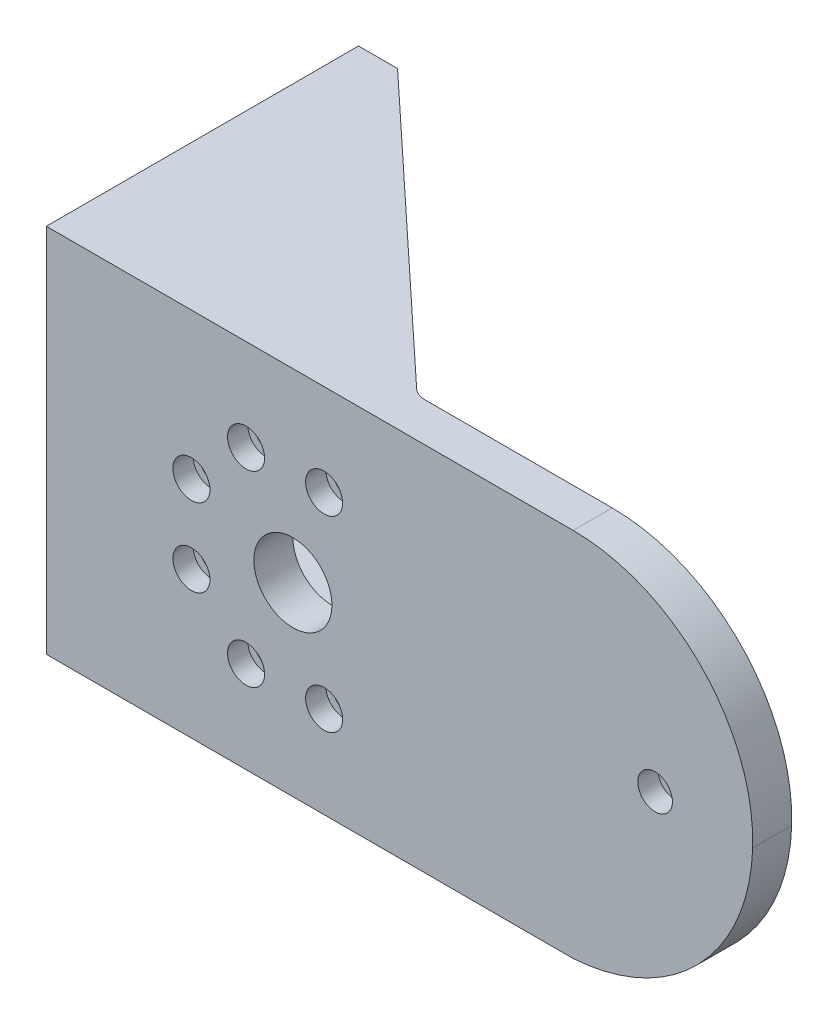
from build123d import *

# Parameters (mm, degrees)
SKETCH3_R           = 2.921
SKETCH3_R_2         = 10
SKETCH3_R_3         = 2.75
BOSS_EXTRUDE1_DEPTH = 10
SKETCH4_W           = 10
SKETCH4_H           = 95
BOSS_EXTRUDE2_DEPTH = 70
SKETCH8_R           = 10
SKETCH8_R_2         = 2.75
CUT_EXTRUDE2_DEPTH  = 43.8
BOSS_EXTRUDE3_DEPTH = 7.5
FILLET1_R           = 5
SKETCH14_R          = 4.75
SKETCH14_R_2        = 4.445
CUT_EXTRUDE4_DEPTH  = 5.2


with BuildPart() as part:
    # Sketch3 → Boss-Extrude1 (new body)
    with BuildSketch(Plane.XY):
        with BuildLine():
            Line((163.617133813, 80.05993294), (203.617133813, 80.05993294))
            ThreePointArc((203.617133813, 80.05993294), (236.678629544, 66.053697227), (249.617133813, 32.55993294))
            ThreePointArc((249.617133813, 32.55993294), (235.791661756, -0.074873068), (203.617133813, -14.94006706))
            Line((203.617133813, -14.94006706), (163.617133813, -14.94006706))
            Line((163.617133813, -14.94006706), (68.617133813, -14.94006706))
            Line((68.617133813, -14.94006706), (68.617133813, 80.05993294))
            Line((68.617133813, 80.05993294), (163.617133813, 80.05993294))
        make_face()
        with Locations((224.617133813, 32.55993294)):
            Circle(SKETCH3_R, mode=Mode.SUBTRACT)
        with Locations((131.802603987, 32.55993294)):
            Circle(SKETCH3_R_2, mode=Mode.SUBTRACT)
        with Locations((139.802603987, 8.55993294)):
            Circle(SKETCH3_R_3, mode=Mode.SUBTRACT)
        with Locations((119.802603987, 8.55993294)):
            Circle(SKETCH3_R_3, mode=Mode.SUBTRACT)
        with Locations((105.802603987, 22.55993294)):
            Circle(SKETCH3_R_3, mode=Mode.SUBTRACT)
        with Locations((105.802603987, 42.55993294)):
            Circle(SKETCH3_R_3, mode=Mode.SUBTRACT)
        with Locations((119.802603987, 56.55993294)):
            Circle(SKETCH3_R_3, mode=Mode.SUBTRACT)
        with Locations((139.802603987, 56.55993294)):
            Circle(SKETCH3_R_3, mode=Mode.SUBTRACT)
    extrude(amount=BOSS_EXTRUDE1_DEPTH)

    # Sketch4 → Boss-Extrude2 (add)
    with BuildSketch(Plane(origin=(0, 0, 0), x_dir=(-1, 0, 0), z_dir=(0, 0, -1))):
        with Locations((-73.617133813, 32.55993294)):
            Rectangle(SKETCH4_W, SKETCH4_H)
    extrude(amount=BOSS_EXTRUDE2_DEPTH)

    # Sketch8 → Cut-Extrude2 (cut)
    with BuildSketch(Plane.ZY.offset(-68.617133813)):
        with Locations((-40, 32.55993294)):
            Circle(SKETCH8_R)
        with Locations((-56.167891819, 25.862972874)):
            Circle(SKETCH8_R_2)
        with Locations((-56.167891819, 39.256893006)):
            Circle(SKETCH8_R_2)
        with Locations((-46.696960066, 48.727824759)):
            Circle(SKETCH8_R_2)
        with Locations((-33.303039934, 48.727824759)):
            Circle(SKETCH8_R_2)
        with Locations((-23.832108181, 39.256893006)):
            Circle(SKETCH8_R_2)
        with Locations((-23.832108181, 25.862972874)):
            Circle(SKETCH8_R_2)
        with Locations((-33.303039934, 16.392041121)):
            Circle(SKETCH8_R_2)
        with Locations((-46.696960066, 16.392041121)):
            Circle(SKETCH8_R_2)
    extrude(amount=-CUT_EXTRUDE2_DEPTH, mode=Mode.SUBTRACT)

    # Sketch9 → Boss-Extrude3 (add)
    with BuildSketch(Plane.XZ.offset(14.94006706)):
        Polygon((78.617133813, -70), (153.617133813, 0), (78.617133813, 0), align=None)
    boss_extrude3 = extrude(amount=-BOSS_EXTRUDE3_DEPTH)

    # Mirror1: Boss-Extrude3 across plane
    add(boss_extrude3.mirror(Plane(origin=(0, 32.55993294, 0), x_dir=(0, 0, 1), z_dir=(0, -1, 0))))

    # Fillet1
    fillet1_edges = [part.edges().sort_by_distance(p)[0] for p in [
        (153.617133813, 76.30993294, 0),
        (153.617133813, -11.19006706, 0),
    ]]
    fillet(fillet1_edges, radius=FILLET1_R)

    # Sketch14 → Cut-Extrude4 (cut)
    with BuildSketch(Plane.XY.offset(10)):
        with Locations((119.802603987, 56.55993294)):
            Circle(SKETCH14_R)
        with Locations((139.802603987, 56.55993294)):
            Circle(SKETCH14_R)
        with Locations((105.802603987, 42.55993294)):
            Circle(SKETCH14_R)
        with Locations((119.802603987, 8.55993294)):
            Circle(SKETCH14_R)
        with Locations((139.802603987, 8.55993294)):
            Circle(SKETCH14_R)
        with Locations((105.802603987, 22.55993294)):
            Circle(SKETCH14_R)
        with Locations((224.617133813, 32.55993294)):
            Circle(SKETCH14_R_2)
    extrude(amount=-CUT_EXTRUDE4_DEPTH, mode=Mode.SUBTRACT)


solid = part.part
